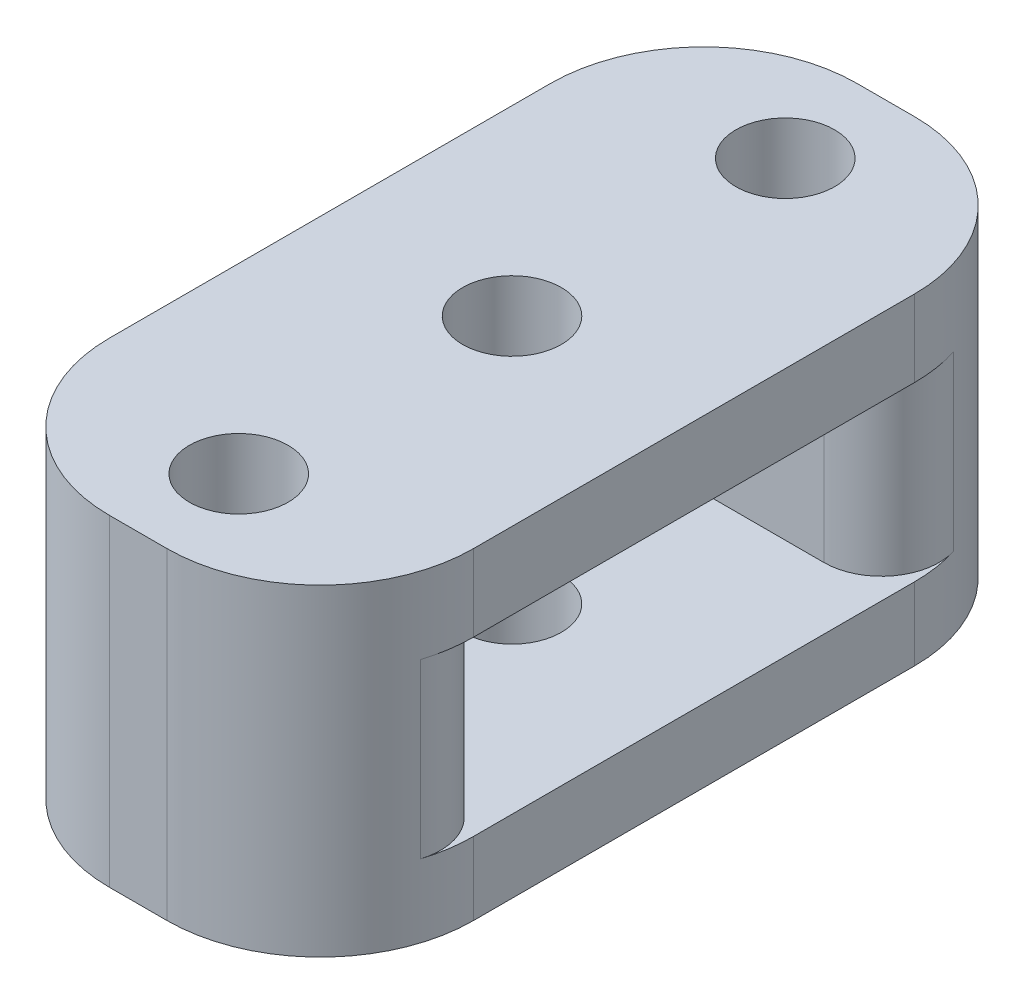
from build123d import *

# Parameters (mm, degrees)
SKETCH1_W           = 19
SKETCH1_H           = 39
SKETCH1_R           = 2.575
BOSS_EXTRUDE1_DEPTH = 3.8
SKETCH2_W           = 19
SKETCH2_H           = 9.5
SKETCH2_R           = 2.575
BOSS_EXTRUDE2_DEPTH = 9
SKETCH3_W           = 19
SKETCH3_H           = 39
SKETCH3_R           = 2.575
BOSS_EXTRUDE3_DEPTH = 4
FILLET1_R           = 8
FILLET2_R           = 3


with BuildPart() as part:
    # Sketch1 → Boss-Extrude1 (new body)
    with BuildSketch(Plane(origin=(0, 0, 0), x_dir=(-1, 0, 0), z_dir=(0, 1, 0))):
        Rectangle(SKETCH1_W, SKETCH1_H)
        with Locations(Location((0, 0, 0), (0, 0, 270))):
            Circle(SKETCH1_R, mode=Mode.SUBTRACT)
        with Locations(Location((0, 14.25, 0), (0, 0, 270))):
            Circle(SKETCH1_R, mode=Mode.SUBTRACT)
        with Locations(Location((0, -14.25, 0), (0, 0, 270))):
            Circle(SKETCH1_R, mode=Mode.SUBTRACT)
    extrude(amount=BOSS_EXTRUDE1_DEPTH)

    # Sketch2 → Boss-Extrude2 (add)
    # profile 1 of 2: a face of its own
    with BuildSketch(Plane(origin=(0, 3.8, 0), x_dir=(-1, 0, 0), z_dir=(0, 1, 0))):
        with Locations((0, 14.75)):
            Rectangle(SKETCH2_W, SKETCH2_H)
        with Locations(Location((0, 14.25, 0), (0, 0, 270))):
            Circle(SKETCH2_R, mode=Mode.SUBTRACT)
    # profile 2 of 2: a face of its own
    with BuildSketch(Plane(origin=(0, 3.8, 0), x_dir=(-1, 0, 0), z_dir=(0, 1, 0))):
        with Locations((0, -14.75)):
            Rectangle(SKETCH2_W, SKETCH2_H)
        with Locations(Location((0, -14.25, 0), (0, 0, 270))):
            Circle(SKETCH2_R, mode=Mode.SUBTRACT)
    extrude(amount=BOSS_EXTRUDE2_DEPTH)

    # Sketch3 → Boss-Extrude3 (add)
    with BuildSketch(Plane(origin=(0, 12.8, 0), x_dir=(-1, 0, 0), z_dir=(0, 1, 0))):
        Rectangle(SKETCH3_W, SKETCH3_H)
        with Locations(Location((0, 14.25, 0), (0, 0, 270))):
            Circle(SKETCH3_R, mode=Mode.SUBTRACT)
        with Locations(Location((0, 0, 0), (0, 0, 270))):
            Circle(SKETCH3_R, mode=Mode.SUBTRACT)
        with Locations(Location((0, -14.25, 0), (0, 0, 270))):
            Circle(SKETCH3_R, mode=Mode.SUBTRACT)
    extrude(amount=BOSS_EXTRUDE3_DEPTH)

    # Fillet1
    fillet1_edges = [part.edges().sort_by_distance(p)[0] for p in [
        (-9.5, 8.4, -19.5),
        (9.5, 8.4, -19.5),
        (9.5, 8.4, 19.5),
        (-9.5, 8.4, 19.5),
    ]]
    fillet(fillet1_edges, radius=FILLET1_R)

    # Fillet2
    # the kernel refuses this fillet: 3 mm, written as the material it takes off along each edge
    with BuildSketch(Plane(origin=(9.5, 3.8, 10), x_dir=(-0.09406475637410622, 0, 0.9955660809852251), z_dir=(0, 1, 0)), Plane(origin=(-9.5, 3.8, -10), x_dir=(0.09406475637410011, 0, -0.9955660809852258), z_dir=(0, 1, 0))) as fillet2_piece_1:
        with BuildLine():
            CenterArc((3.290556001, -2.933786817), FILLET2_R, 77.939890127, 107.457603124)
            Line((0.303857758, -3.215981087), (0.005187934, -3.244200514))
            Line((0.005187934, -3.244200514), (-0.298669824, -0.028219427))
            Line((-0.298669824, -0.028219427), (-0.028219427, 0.298669824))
            ThreePointArc((-0.028219427, 0.298669824), (1.465129695, 0.439766959), (3.980050628, 0.293378682))
            Line((3.980050628, 0.293378682), (3.917369298, 0))
        make_face()
    extrude(amount=9, mode=Mode.SUBTRACT)
    with BuildSketch(Plane(origin=(-9.5, 3.8, 10), x_dir=(0.09406475637410577, 0, 0.9955660809852253), z_dir=(0, 1, 0)), Plane(origin=(9.5, 3.8, -10), x_dir=(-0.09406475637410053, 0, -0.9955660809852258), z_dir=(0, 1, 0))) as fillet2_piece_2:
        with BuildLine():
            CenterArc((3.290556001, 2.933786817), FILLET2_R, 174.602506749, 107.457603124)
            Line((0.303857758, 3.215981087), (0.005187934, 3.244200514))
            Line((0.005187934, 3.244200514), (-0.298669824, 0.028219427))
            Line((-0.298669824, 0.028219427), (-0.028219427, -0.298669824))
            ThreePointArc((-0.028219427, -0.298669824), (1.465129695, -0.439766959), (3.980050628, -0.293378682))
            Line((3.980050628, -0.293378682), (3.917369298, 0))
        make_face()
    extrude(amount=9, mode=Mode.SUBTRACT)


solid = part.part
